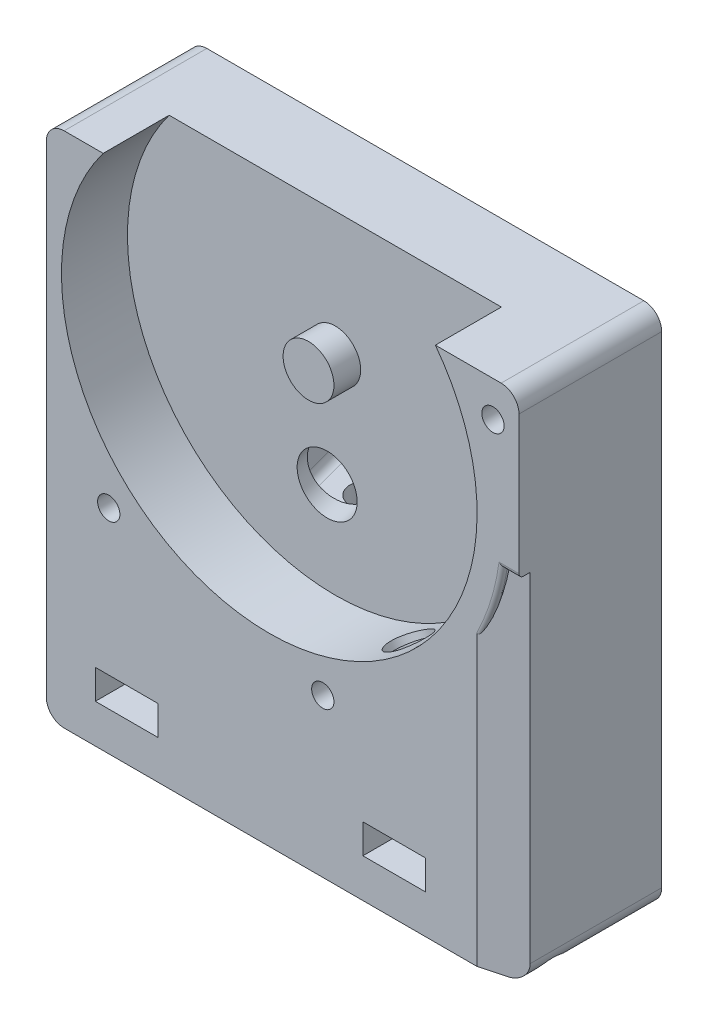
from build123d import *

# Parameters (mm, degrees)
BOSS_EXTRUDE1_DEPTH      = 4
BOSS_EXTRUDE1_DEPTH_BACK = 12
SKETCH1_W                = 53
SKETCH1_H                = 58
CUT_EXTRUDE1_DEPTH       = 4
CUT_EXTRUDE1_DEPTH_BACK  = 3.4
SKETCH2_R                = 23.3
SKETCH3_R                = 2.85
BOSS_EXTRUDE2_DEPTH      = 3
SKETCH4_R                = 2.25
CUT_EXTRUDE2_DEPTH       = 32
SKETCH5_R                = 2.6
CUT_EXTRUDE3_DEPTH       = 30
SKETCH6_R                = 3.25
CUT_EXTRUDE4_DEPTH       = 44.462627624
CUT_EXTRUDE5_DEPTH       = 8
SKETCH11_R               = 1.5
CUT_EXTRUDE6_DEPTH       = 27
SKETCH12_R               = 2
CUT_EXTRUDE7_DEPTH       = 27
SKETCH13_R               = 1.25
CUT_EXTRUDE8_DEPTH       = 10
FILLET1_R                = 2
CUT_EXTRUDE9_DEPTH       = 40
BOSS_EXTRUDE3_START      = -3
BOSS_EXTRUDE3_DEPTH      = 3
FILLET3_R                = 0.5
CUT_EXTRUDE11_DEPTH      = 1.65
CUT_EXTRUDE12_REACH      = 67.513
SKETCH18_R               = 2.1


with BuildPart() as part:
    # Sketch1 → Boss-Extrude1 (new, two sides: drawn at the far end of the back side and taken through both)
    with BuildSketch(Plane.XY.offset(-BOSS_EXTRUDE1_DEPTH_BACK)):
        with Locations((1.5, -2)):
            Rectangle(SKETCH1_W, SKETCH1_H)
    extrude(amount=BOSS_EXTRUDE1_DEPTH + BOSS_EXTRUDE1_DEPTH_BACK)

    # Sketch2 → Cut-Extrude1 (cut, two sides: drawn at the far end of the back side and taken through both)
    with BuildSketch(Plane.XY.offset(-CUT_EXTRUDE1_DEPTH_BACK)):
        with Locations((0, 13)):
            Circle(SKETCH2_R)
    extrude(amount=CUT_EXTRUDE1_DEPTH + CUT_EXTRUDE1_DEPTH_BACK, mode=Mode.SUBTRACT)

    # Sketch3 → Boss-Extrude2 (add)
    with BuildSketch(Plane.XY.offset(-3.4)):
        with Locations((0, 13)):
            Circle(SKETCH3_R)
    extrude(amount=BOSS_EXTRUDE2_DEPTH)

    # Sketch4 → Cut-Extrude2 (cut)
    with BuildSketch(Plane(origin=(21.370834875, -37.015371804, 0), x_dir=(0, 0, 1), z_dir=(-0.500000000000001, 0.866025403784438, 0))):
        with Locations(Location((0, 6.5, 0), (0, 0, 90))):
            Circle(SKETCH4_R)
    extrude(amount=CUT_EXTRUDE2_DEPTH, mode=Mode.SUBTRACT)

    # Sketch5 → Cut-Extrude3 (cut)
    with BuildSketch(Plane(origin=(21.370834875, -37.015371804, 0), x_dir=(0, 0, 1), z_dir=(-0.500000000000001, 0.866025403784438, 0))):
        with Locations(Location((0, 6.5, 0), (0, 0, 120.129971207))):
            Circle(SKETCH5_R)
    extrude(amount=CUT_EXTRUDE3_DEPTH, mode=Mode.SUBTRACT)

    # Sketch6 → Cut-Extrude4 (cut, through all)
    with BuildSketch(Plane(origin=(0, 0, 0), x_dir=(0, -1, 0), z_dir=(0.25881904510252135, 0, 0.9659258262890681))):
        with Locations(Location((0, 0, 0), (0, 0, 90))):
            Circle(SKETCH6_R)
    extrude(amount=-CUT_EXTRUDE4_DEPTH, mode=Mode.SUBTRACT)

    # Sketch10 → Cut-Extrude5 (cut)
    with BuildSketch(Plane(origin=(-3.623466631, 0, -13.522961568), x_dir=(0, -1, 0), z_dir=(0.25881904510252135, 0, 0.9659258262890681))):
        with BuildLine():
            Line((4, 5), (-4, 5))
            ThreePointArc((-4, 5), (-4.707106781, 4.707106781), (-5, 4))
            Line((-5, 4), (-5, -4))
            ThreePointArc((-5, -4), (-4.707106781, -4.707106781), (-4, -5))
            Line((-4, -5), (4, -5))
            ThreePointArc((4, -5), (4.707106781, -4.707106781), (5, -4))
            Line((5, -4), (5, 4))
            ThreePointArc((5, 4), (4.707106781, 4.707106781), (4, 5))
        make_face()
    extrude(amount=CUT_EXTRUDE5_DEPTH, mode=Mode.SUBTRACT)

    # Sketch11 → Cut-Extrude6 (cut)
    with BuildSketch(Plane.XZ.offset(31)):
        with Locations(Location((-2.588190451, -9.659258263, 0), (0, 0, 270))):
            Circle(SKETCH11_R)
    extrude(amount=-CUT_EXTRUDE6_DEPTH, mode=Mode.SUBTRACT)

    # Sketch12 → Cut-Extrude7 (cut)
    with BuildSketch(Plane.XZ.offset(31)):
        with Locations(Location((-2.588190451, -9.659258263, 0), (0, 0, 270))):
            Circle(SKETCH12_R)
    extrude(amount=-CUT_EXTRUDE7_DEPTH, mode=Mode.SUBTRACT)

    # Sketch13 → Cut-Extrude8 (cut)
    with BuildSketch(Plane.XY.offset(4)):
        with Locations((25.079872408, 23)):
            Circle(SKETCH13_R)
        with Locations((-18, -7.124611797)):
            Circle(SKETCH13_R)
        with Locations((6, -13.324893162)):
            Circle(SKETCH13_R)
    extrude(amount=-CUT_EXTRUDE8_DEPTH, mode=Mode.SUBTRACT)

    # Fillet1
    # the kernel refuses this fillet: 2 mm, written as the material it takes off along each edge
    with BuildSketch(Plane(origin=(28, -31, 9), x_dir=(0, 1, 0), z_dir=(0, 0, -1))) as fillet1_piece_1:
        with BuildLine():
            CenterArc((FILLET1_R, -FILLET1_R), FILLET1_R, 90, 90)
            Line((0, -FILLET1_R), (0, 0))
            Line((0, 0), (FILLET1_R, 0))
        make_face()
    extrude(amount=12.694895612, mode=Mode.SUBTRACT)
    with BuildSketch(Plane(origin=(-25, 27, -17), x_dir=(1, 0, 0), z_dir=(0, 0, 1)), Plane(origin=(28, 27, 9), x_dir=(-1, 0, 0), z_dir=(0, 0, -1)), Plane(origin=(-25, -31, -17), x_dir=(0, 1, 0), z_dir=(0, 0, 1))) as fillet1_piece_2:
        with BuildLine():
            CenterArc((FILLET1_R, -FILLET1_R), FILLET1_R, 90, 90)
            Line((0, -FILLET1_R), (0, 0))
            Line((0, 0), (FILLET1_R, 0))
        make_face()
    extrude(amount=26, mode=Mode.SUBTRACT)
    with BuildSketch(Plane(origin=(28, -31, 3.694895612), x_dir=(0, 1, 0), z_dir=(0, 0, -1))) as fillet1_piece_3:
        with BuildLine():
            CenterArc((FILLET1_R, -FILLET1_R), FILLET1_R, 90, 90)
            Line((0, -FILLET1_R), (0, 0))
            Line((0, 0), (FILLET1_R, 0))
        make_face()
    extrude(amount=20.694895612, mode=Mode.SUBTRACT)

    # Sketch14 → Cut-Extrude9 (cut)
    with BuildSketch(Plane.XZ.offset(31)):
        Polygon((23.3, 4), (28, 2.740638796), (28, 4), align=None)
    extrude(amount=-CUT_EXTRUDE9_DEPTH, mode=Mode.SUBTRACT)

    # Sketch15 → Boss-Extrude3 (add)
    with BuildSketch(Plane.XY.offset(4).offset(BOSS_EXTRUDE3_START)):
        with BuildLine():
            Line((23.246505231, 11.422028337), (26.452977251, 11.422028337))
            ThreePointArc((26.452977251, 11.422028337), (25.46678498, 5.672458614), (23.246505231, 0.277972073))
            Line((23.246505231, 0.277972073), (20.59705621, 2.107283375))
            ThreePointArc((20.59705621, 2.107283375), (22.41105951, 6.625487343), (23.246505231, 11.422028337))
        make_face()
    extrude(amount=BOSS_EXTRUDE3_DEPTH)

    # Fillet3
    fillet3_edges = [part.edges().sort_by_distance(p)[0] for p in [
        (27.098186897, 9, 4),
        (25.121010739, 4.562890339, 4),
    ]]
    fillet(fillet3_edges, radius=FILLET3_R)

    # Sketch17 → Cut-Extrude11 (cut, symmetric)
    with BuildSketch(Plane(origin=(0, -25, 0), x_dir=(1, 0, 0), z_dir=(0, 1, 0))):
        Polygon((-12.5, 6.020725942), (-16, 8.041451884), (-19.5, 6.020725942), (-19.5, 1.979274058), (-19.5, -4), (-12.5, -4), (-12.5, 1.979274058), align=None)
        Polygon((17.5, 6.020725942), (14, 8.041451884), (10.5, 6.020725942), (10.5, 1.979274058), (10.5, -4), (17.5, -4), (17.5, 1.979274058), align=None)
    extrude(amount=CUT_EXTRUDE11_DEPTH, both=True, mode=Mode.SUBTRACT)

    # Sketch18 → Cut-Extrude12 (cut, up to next)
    with BuildSketch(Plane.XZ.offset(31), mode=Mode.PRIVATE) as cut_extrude12_sk1:
        with Locations(Location((-16, -4, 0), (0, 0, 270))):
            Circle(SKETCH18_R)
    cut_extrude12_tool1 = extrude(cut_extrude12_sk1.sketch, amount=-CUT_EXTRUDE12_REACH, mode=Mode.PRIVATE) & part.part
    # Sketch18 → Cut-Extrude12 (cut, up to next)
    with BuildSketch(Plane.XZ.offset(31), mode=Mode.PRIVATE) as cut_extrude12_sk2:
        with Locations(Location((14, -4, 0), (0, 0, 270))):
            Circle(SKETCH18_R)
    cut_extrude12_tool2 = extrude(cut_extrude12_sk2.sketch, amount=-CUT_EXTRUDE12_REACH, mode=Mode.PRIVATE) & part.part
    add(cut_extrude12_tool1.solids().sort_by_distance((-16, -31, -4))[0], mode=Mode.SUBTRACT)
    add(cut_extrude12_tool2.solids().sort_by_distance((14, -31, -4))[0], mode=Mode.SUBTRACT)


solid = part.part
